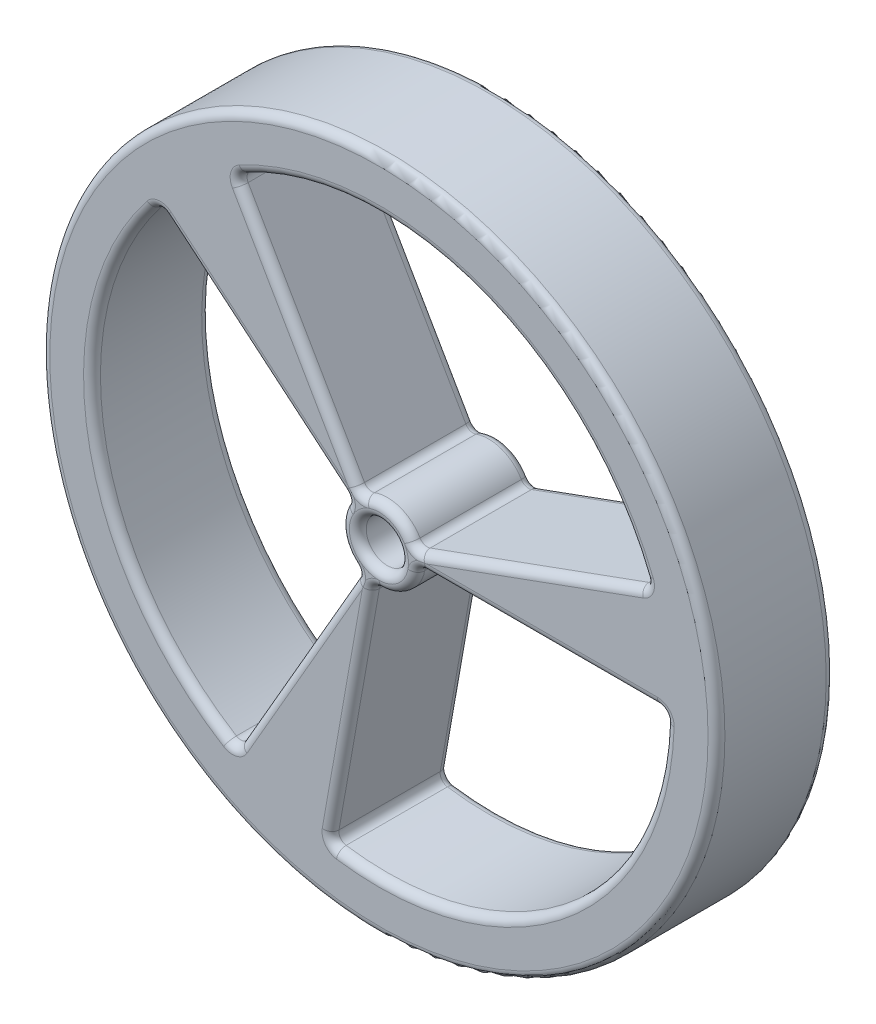
from build123d import *

# Parameters (mm, degrees)
SKETCH1_R           = 20
SKETCH1_R_2         = 1.2500000000000002
BOSS_EXTRUDE1_DEPTH = 7
FILLET1_R           = 0.5


with BuildPart() as part:
    # Sketch1 → Boss-Extrude1 (new body)
    with BuildSketch(Plane.XY):
        Circle(SKETCH1_R)
        Circle(SKETCH1_R_2, mode=Mode.SUBTRACT)
        with BuildLine():
            Line((2.2500000000000004, 2.2e-16), (17, 0))
            ThreePointArc((17, 0), (10.927389364671175, -13.02275553302262), (-2.952019020337799, -16.74173180120754))
            Line((-2.952019020337799, -16.74173180120754), (-0.3907083997505899, -2.2158174442774694))
            ThreePointArc((-0.3907083997505899, -2.2158174442774694), (1.4462721217947154, -1.7235999970177003), (2.2500000000000004, 2.2e-16))
        make_face(mode=Mode.SUBTRACT)
        with BuildLine():
            Line((2.114308396768293, 0.7695453224827578), (15.974774553360438, 5.81434243653638))
            ThreePointArc((15.974774553360438, 5.81434243653638), (5.814342436536355, 15.974774553360447), (-8.500000000000007, 14.722431864335453))
            Line((-8.500000000000007, 14.722431864335453), (-1.124999999999982, 1.9485571585149977))
            ThreePointArc((-1.124999999999982, 1.9485571585149977), (0.769545322482763, 2.1143083967682914), (2.114308396768293, 0.7695453224827578))
        make_face(mode=Mode.SUBTRACT)
        with BuildLine():
            Line((-1.1250000000000093, -1.9485571585149826), (-8.499999999999996, -14.72243186433546))
            ThreePointArc((-8.499999999999996, -14.72243186433546), (-16.741731801207536, -2.9520190203378256), (-13.022755533022641, 10.927389364671152))
            Line((-13.022755533022641, 10.927389364671152), (-1.7235999970177038, 1.4462721217947108))
            ThreePointArc((-1.7235999970177038, 1.4462721217947108), (-2.21581744427747, -0.3907083997505898), (-1.1250000000000093, -1.9485571585149826))
        make_face(mode=Mode.SUBTRACT)
    extrude(amount=BOSS_EXTRUDE1_DEPTH)

    # Fillet1
    # the kernel refuses this fillet: 0.5 mm, written as the material it adds along each edge
    with BuildSketch(Plane(origin=(2.2500000000000004, 1.6e-16, 0), x_dir=(-0.09129028963796376, -0.9958243233712545, 0), z_dir=(0, 0, 1))) as fillet1_piece_1:
        with BuildLine():
            CenterArc((0.45645144818981753, 0.4979121616856275), FILLET1_R, 185.23784084819494, 79.52431830361013)
            Line((-0.04146071349580971, 0.45226701686664567), (0, 0))
            ThreePointArc((0, 0), (0.20540315168541826, 0.00939527241467802), (0.410806303370836, 0))
        make_face()
    extrude(amount=7)
    with BuildSketch(Plane(origin=(-0.39070839975058996, -2.2158174442774694, 0), x_dir=(-0.17364817766692953, -0.9848077530122082, 0), z_dir=(0, 0, 1))) as fillet1_piece_2:
        with BuildLine():
            CenterArc((0.45416345659799273, 0.5), FILLET1_R, 190.47568169638987, 79.52431830361013)
            ThreePointArc((-0.03750262641982422, 0.4090909090909092), (-0.00939527241467734, 0.2054031516854181), (0, 0))
            Line((0, 0), (0.4541634565979929, -1e-17))
        make_face()
    extrude(amount=7)
    with BuildSketch(Plane(origin=(-2.952019020337798, -16.741731801207536, 0), x_dir=(0.1736481776669282, 0.9848077530122085, 0), z_dir=(0, 0, 1))) as fillet1_piece_3:
        with BuildLine():
            CenterArc((0.507577497529364, -0.5000000000000001), FILLET1_R, 90.0000000000001, 91.73650157593738)
            ThreePointArc((0.00780711866661539, -0.5151515151515117), (0.00195189172197935, -0.25760533508876227), (0, 0))
            Line((0, 0), (0.5075774975293631, 0))
        make_face()
    extrude(amount=7)
    with BuildSketch(Plane(origin=(17, 0, 0), x_dir=(-1, 0, 0), z_dir=(0, 0, 1))) as fillet1_piece_4:
        with BuildLine():
            CenterArc((0.5075774975293577, 0.5), FILLET1_R, 178.26349842406205, 91.73650157593795)
            ThreePointArc((0.00780711866661221, 0.5151515151515155), (0.0019518917219834, 0.25760533508876354), (0, 0))
            Line((0, 0), (0.5075774975293577, 0))
        make_face()
    extrude(amount=7)
    with BuildSketch(Plane(origin=(-1.124999999999982, 1.9485571585149977, 0), x_dir=(0.9080543065649411, 0.4188524517403044, 0), z_dir=(0, 0, 1))) as fillet1_piece_5:
        with BuildLine():
            CenterArc((0.4564514481898126, 0.4979121616856273), FILLET1_R, 185.23784084819536, 79.52431830360973)
            Line((-0.04146071349581421, 0.45226701686664206), (0, 0))
            ThreePointArc((0, 0), (0.2054031516854157, 0.00939527241467739), (0.4108063033708312, -1e-17))
        make_face()
    extrude(amount=7)
    with BuildSketch(Plane(origin=(2.114308396768293, 0.7695453224827578, 0), x_dir=(0.9396926207859083, 0.342020143325669, 0), z_dir=(0, 0, 1))) as fillet1_piece_6:
        with BuildLine():
            CenterArc((0.45416345659799173, 0.5), FILLET1_R, 190.47568169638987, 79.52431830361013)
            ThreePointArc((-0.0375026264198251, 0.40909090909090934), (-0.00939527241467807, 0.20540315168541814), (0, 0))
            Line((0, 0), (0.4541634565979919, 0))
        make_face()
    extrude(amount=7)
    with BuildSketch(Plane(origin=(15.974774553360438, 5.81434243653638, 0), x_dir=(-0.3562202754534076, 0.934402009499069, 0), z_dir=(0, 0, 1))) as fillet1_piece_7:
        with BuildLine():
            CenterArc((0.5076340426749175, 0.4999425914199416), FILLET1_R, 179.13174921203125, 91.7365015759375)
            Line((0.00769145125497602, 0.5075192189225506), (0, 0))
            ThreePointArc((0, 0), (0.2576053350887624, -0.00195189172198738), (0.5152106701775263, -1e-17))
        make_face()
    extrude(amount=7)
    with BuildSketch(Plane(origin=(-8.500000000000007, 14.722431864335451, 0), x_dir=(0.8735025967095982, 0.4868194876353957, 0), z_dir=(0, 0, 1))) as fillet1_piece_8:
        with BuildLine():
            CenterArc((0.5076340426749291, -0.4999425914199411), FILLET1_R, 89.13174921203108, 91.73650157594159)
            Line((0.00769145125498728, -0.5075192189225846), (0, 0))
            ThreePointArc((0, 0), (0.2576053350887707, 0.00195189172198515), (0.5152106701775395, -3e-17))
        make_face()
    extrude(amount=7)
    with BuildSketch(Plane(origin=(-1.1250000000000093, -1.9485571585149826, 0), x_dir=(-0.8167640169269716, 0.5769718716309467, 0), z_dir=(0, 0, 1))) as fillet1_piece_9:
        with BuildLine():
            CenterArc((0.4564514481898149, 0.49791216168562746), FILLET1_R, 185.23784084819533, 79.52431830360979)
            Line((-0.0414607134958118, 0.4522670168666425), (0, 0))
            ThreePointArc((0, 0), (0.20540315168541656, 0.00939527241467738), (0.41080630337083374, 2e-17))
        make_face()
    extrude(amount=7)
    with BuildSketch(Plane(origin=(-1.723599997017704, 1.4462721217947108, 0), x_dir=(-0.570171117399639, -0.8215259563052449, 0), z_dir=(0, 0, 1))) as fillet1_piece_10:
        with BuildLine():
            CenterArc((0.4564514481898163, -0.49791216168562724), FILLET1_R, 95.23784084819494, 79.52431830361033)
            Line((-0.04146071349581091, -0.45226701686664733), (0, 0))
            ThreePointArc((0, 0), (0.20540315168541748, -0.00939527241467721), (0.4108063033708347, 1e-17))
        make_face()
    extrude(amount=7)
    with BuildSketch(Plane(origin=(-13.022755533022641, 10.927389364671152, 0), x_dir=(-0.6311057398467204, -0.7756968126352742, 0), z_dir=(0, 0, 1))) as fillet1_piece_11:
        with BuildLine():
            CenterArc((0.507634042674936, 0.49994259141994163), FILLET1_R, 179.13174921203353, 91.73650157593528)
            Line((0.0076914512549941, 0.5075192189225307), (0, 0))
            ThreePointArc((0, 0), (0.2576053350887728, -0.00195189172198576), (0.5152106701775455, 0))
        make_face()
    extrude(amount=7)
    with BuildSketch(Plane(origin=(-8.499999999999996, -14.72243186433546, 0), x_dir=(0.5000000000000008, 0.8660254037844382, 0), z_dir=(0, 0, 1))) as fillet1_piece_12:
        with BuildLine():
            CenterArc((0.5075774975293567, 0.4999999999999995), FILLET1_R, 178.2634984240622, 91.73650157593784)
            ThreePointArc((0.00780711866660927, 0.5151515151515137), (0.001951891721983, 0.2576053350887633), (0, 0))
            Line((0, 0), (0.5075774975293569, 1e-17))
        make_face()
    extrude(amount=7)
    # the kernel refuses this fillet: 0.5 mm, written as the material it takes off along each edge
    with BuildSketch(Plane(origin=(0, 0, 0), x_dir=(1, 0, 0), z_dir=(0, -1, 0))) as fillet1_2_piece_1:
        with BuildLine():
            CenterArc((20 - FILLET1_R, FILLET1_R), FILLET1_R, 270, 90)
            Line((20 - FILLET1_R, -6e-17), (20, 0))
            Line((20, 0), (20, FILLET1_R))
        make_face()
    revolve(axis=Axis((0, 0, 0), (0, 0, 1)), mode=Mode.SUBTRACT)
    with BuildSketch(Plane(origin=(0, 0, 7), x_dir=(1, 0, 0), z_dir=(0, -1, 0))) as fillet1_2_piece_2:
        with BuildLine():
            CenterArc((20 - FILLET1_R, -FILLET1_R), FILLET1_R, 0, 90)
            Line((20 - FILLET1_R, 0), (20, 0))
            Line((20, 0), (20, -FILLET1_R))
        make_face()
    revolve(axis=Axis((0, 0, 7), (0, 0, 1)), mode=Mode.SUBTRACT)
    with BuildSketch(Plane(origin=(0, 0, 0), x_dir=(1, 0, 0), z_dir=(0, -1, 0))) as fillet1_2_piece_3:
        with BuildLine():
            CenterArc((1.2500000000000002 + FILLET1_R, FILLET1_R), FILLET1_R, 180, 90)
            Line((1.2500000000000002, FILLET1_R), (1.2500000000000002, 0))
            Line((1.2500000000000002, 0), (1.2500000000000002 + FILLET1_R, 0))
        make_face()
    revolve(axis=Axis((0, 0, 0), (0, 0, 1)), mode=Mode.SUBTRACT)
    with BuildSketch(Plane(origin=(0, 0, 7), x_dir=(1, 0, 0), z_dir=(0, -1, 0))) as fillet1_2_piece_4:
        with BuildLine():
            CenterArc((1.2500000000000002 + FILLET1_R, -FILLET1_R), FILLET1_R, 90, 90)
            Line((1.2500000000000002, -FILLET1_R), (1.2500000000000002, 0))
            Line((1.2500000000000002, 0), (1.2500000000000002 + FILLET1_R, 0))
        make_face()
    revolve(axis=Axis((0, 0, 7), (0, 0, 1)), mode=Mode.SUBTRACT)
    # the kernel refuses this fillet: 0.5 mm, written as the material it takes off along each edge
    with BuildSketch(Plane(origin=(4.4e-16, -7.2e-16, 0), x_dir=(0.008302116419766921, -0.9999655368376216, 0), z_dir=(-0.9999655368376216, -0.008302116419766921, 0))) as fillet1_3_piece_1:
        with BuildLine():
            CenterArc((2.2500000000000004 - FILLET1_R, FILLET1_R), FILLET1_R, 270, 90)
            Line((2.2500000000000004, FILLET1_R), (2.2500000000000004, 0))
            Line((2.2500000000000004, 0), (2.2500000000000004 - FILLET1_R, 0))
        make_face()
    revolve(axis=Axis((4.4e-16, -7.2e-16, 0), (0, 0, 1)), revolution_arc=79.04863660722016, mode=Mode.SUBTRACT)
    with BuildSketch(Plane(origin=(-2.863879112867084, -16.241865546386084, 0), x_dir=(-0.9848077530122082, 0.17364817766692942, 0), z_dir=(0.17364817766692944, 0.9848077530122082, 0))) as fillet1_3_piece_2:
        with BuildLine():
            CenterArc((FILLET1_R, FILLET1_R), FILLET1_R, 180, 90)
            Line((-4.4e-16, FILLET1_R), (0, 0))
            Line((0, 0), (FILLET1_R, 0))
        make_face()
    extrude(amount=13.788259045872639, mode=Mode.SUBTRACT)
    with BuildSketch(Plane(origin=(-7.55e-15, 1.11e-14, 0), x_dir=(0.9995407577254936, -0.03030303030303098, 0), z_dir=(0.03030303030303098, 0.9995407577254936, 0))) as fillet1_3_piece_3:
        with BuildLine():
            CenterArc((17.000000000000007 + FILLET1_R, -FILLET1_R), FILLET1_R, 90, 90)
            Line((17.000000000000007, -FILLET1_R), (17.000000000000007, 0))
            Line((17.000000000000007, 0), (17.000000000000007 + FILLET1_R, 0))
        make_face()
    revolve(axis=Axis((-7.55e-15, 1.11e-14, 0), (0, 0, -1)), revolution_arc=96.52699684812407, mode=Mode.SUBTRACT)
    with BuildSketch(Plane(origin=(2.7041634565979926, 2.1e-16, 0), x_dir=(1e-17, 1, 0), z_dir=(1, -1e-17, 0))) as fillet1_3_piece_4:
        with BuildLine():
            CenterArc((FILLET1_R, FILLET1_R), FILLET1_R, 180, 90)
            Line((-1e-16, FILLET1_R), (0, 0))
            Line((0, 0), (FILLET1_R, 0))
        make_face()
    extrude(amount=13.78825904587265, mode=Mode.SUBTRACT)
    with BuildSketch(Plane(origin=(4.4e-16, -7.2e-16, 7), x_dir=(0.008302116419766921, -0.9999655368376216, 0), z_dir=(-0.9999655368376216, -0.008302116419766921, 0))) as fillet1_3_piece_5:
        with BuildLine():
            CenterArc((2.2500000000000004 - FILLET1_R, -FILLET1_R), FILLET1_R, 0, 90)
            Line((2.2500000000000004, -FILLET1_R), (2.2500000000000004, 0))
            Line((2.2500000000000004, 0), (2.2500000000000004 - FILLET1_R, 0))
        make_face()
    revolve(axis=Axis((4.4e-16, -7.2e-16, 7), (0, 0, 1)), revolution_arc=79.04863660722016, mode=Mode.SUBTRACT)
    with BuildSketch(Plane(origin=(-2.863879112867084, -16.241865546386084, 7), x_dir=(-0.9848077530122082, 0.17364817766692942, 0), z_dir=(0.17364817766692944, 0.9848077530122082, 0))) as fillet1_3_piece_6:
        with BuildLine():
            CenterArc((FILLET1_R, -FILLET1_R), FILLET1_R, 90, 90)
            Line((-4.4e-16, -FILLET1_R), (0, 0))
            Line((0, 0), (FILLET1_R, 0))
        make_face()
    extrude(amount=13.788259045872639, mode=Mode.SUBTRACT)
    with BuildSketch(Plane(origin=(-7.55e-15, 1.11e-14, 7), x_dir=(0.9995407577254936, -0.03030303030303098, 0), z_dir=(0.03030303030303098, 0.9995407577254936, 0))) as fillet1_3_piece_7:
        with BuildLine():
            CenterArc((17.000000000000007 + FILLET1_R, FILLET1_R), FILLET1_R, 180, 90)
            Line((17.000000000000007, FILLET1_R), (17.000000000000007, 0))
            Line((17.000000000000007, 0), (17.000000000000007 + FILLET1_R, 0))
        make_face()
    revolve(axis=Axis((-7.55e-15, 1.11e-14, 7), (0, 0, -1)), revolution_arc=96.52699684812407, mode=Mode.SUBTRACT)
    with BuildSketch(Plane(origin=(2.7041634565979926, 2.1e-16, 7), x_dir=(1e-17, 1, 0), z_dir=(1, -1e-17, 0))) as fillet1_3_piece_8:
        with BuildLine():
            CenterArc((FILLET1_R, -FILLET1_R), FILLET1_R, 90, 90)
            Line((-1e-16, -FILLET1_R), (0, 0))
            Line((0, 0), (FILLET1_R, 0))
        make_face()
    extrude(amount=13.78825904587265, mode=Mode.SUBTRACT)
    with BuildSketch(Plane(origin=(6e-17, -1.1e-16, 0), x_dir=(-0.3342069186933668, 0.9424997270543294, 0), z_dir=(-0.9424997270543294, -0.3342069186933668, 0))) as fillet1_3_piece_9:
        with BuildLine():
            CenterArc((2.2500000000000004 - FILLET1_R, -FILLET1_R), FILLET1_R, 6.36e-15, 90)
            Line((2.2500000000000004, -FILLET1_R), (2.2500000000000004, 0))
            Line((2.2500000000000004, 0), (2.2500000000000004 - FILLET1_R, 0))
        make_face()
    revolve(axis=Axis((6e-17, -1.1e-16, 0), (0, 0, -1)), revolution_arc=79.04863660721972, mode=Mode.SUBTRACT)
    with BuildSketch(Plane(origin=(2.5410824455640473, 0.9248783730016843, 0), x_dir=(0.3420201433256693, -0.9396926207859082, 0), z_dir=(0.9396926207859082, 0.3420201433256693, 0))) as fillet1_3_piece_10:
        with BuildLine():
            CenterArc((FILLET1_R, -FILLET1_R), FILLET1_R, 90, 90)
            Line((0, -FILLET1_R), (0, 0))
            Line((0, 0), (FILLET1_R, 0))
        make_face()
    extrude(amount=13.788259045872653, mode=Mode.SUBTRACT)
    with BuildSketch(Plane(origin=(-2.2e-16, -1.78e-15, 0), x_dir=(0.9288968274419568, 0.3703386071803309, 0), z_dir=(0.3703386071803309, -0.9288968274419568, 0))) as fillet1_3_piece_11:
        with BuildLine():
            CenterArc((17 + FILLET1_R, FILLET1_R), FILLET1_R, 180, 90)
            Line((16.999999999999996, FILLET1_R), (17, 0))
            Line((17, 0), (17 + FILLET1_R, 0))
        make_face()
    revolve(axis=Axis((-2.2e-16, -1.78e-15, 0), (0, 0, 1)), revolution_arc=96.52699684812413, mode=Mode.SUBTRACT)
    with BuildSketch(Plane(origin=(-8.24621125123531, 14.282856857085667, 0), x_dir=(-0.8660254037844377, -0.5000000000000017, 0), z_dir=(0.5000000000000017, -0.8660254037844377, 0))) as fillet1_3_piece_12:
        with BuildLine():
            CenterArc((FILLET1_R, -FILLET1_R), FILLET1_R, 90, 90)
            Line((-8.9e-16, -FILLET1_R), (0, 0))
            Line((0, 0), (FILLET1_R, 0))
        make_face()
    extrude(amount=13.78825904587262, mode=Mode.SUBTRACT)
    with BuildSketch(Plane(origin=(6e-17, -1.1e-16, 7), x_dir=(-0.3342069186933668, 0.9424997270543294, 0), z_dir=(-0.9424997270543294, -0.3342069186933668, 0))) as fillet1_3_piece_13:
        with BuildLine():
            CenterArc((2.2500000000000004 - FILLET1_R, FILLET1_R), FILLET1_R, 270, 90)
            Line((2.2500000000000004, FILLET1_R), (2.2500000000000004, 0))
            Line((2.2500000000000004, 0), (2.2500000000000004 - FILLET1_R, 0))
        make_face()
    revolve(axis=Axis((6e-17, -1.1e-16, 7), (0, 0, -1)), revolution_arc=79.04863660721972, mode=Mode.SUBTRACT)
    with BuildSketch(Plane(origin=(2.5410824455640473, 0.9248783730016843, 7), x_dir=(0.3420201433256693, -0.9396926207859082, 0), z_dir=(0.9396926207859082, 0.3420201433256693, 0))) as fillet1_3_piece_14:
        with BuildLine():
            CenterArc((FILLET1_R, FILLET1_R), FILLET1_R, 180, 90)
            Line((0, FILLET1_R), (0, 0))
            Line((0, 0), (FILLET1_R, 0))
        make_face()
    extrude(amount=13.788259045872653, mode=Mode.SUBTRACT)
    with BuildSketch(Plane(origin=(-2.2e-16, -1.78e-15, 7), x_dir=(0.9288968274419568, 0.3703386071803309, 0), z_dir=(0.3703386071803309, -0.9288968274419568, 0))) as fillet1_3_piece_15:
        with BuildLine():
            CenterArc((17 + FILLET1_R, -FILLET1_R), FILLET1_R, 90, 90)
            Line((16.999999999999996, -FILLET1_R), (17, 0))
            Line((17, 0), (17 + FILLET1_R, 0))
        make_face()
    revolve(axis=Axis((-2.2e-16, -1.78e-15, 7), (0, 0, 1)), revolution_arc=96.52699684812413, mode=Mode.SUBTRACT)
    with BuildSketch(Plane(origin=(-8.24621125123531, 14.282856857085667, 7), x_dir=(-0.8660254037844377, -0.5000000000000017, 0), z_dir=(0.5000000000000017, -0.8660254037844377, 0))) as fillet1_3_piece_16:
        with BuildLine():
            CenterArc((FILLET1_R, FILLET1_R), FILLET1_R, 180, 90)
            Line((-8.9e-16, FILLET1_R), (0, 0))
            Line((0, 0), (FILLET1_R, 0))
        make_face()
    extrude(amount=13.78825904587262, mode=Mode.SUBTRACT)
    with BuildSketch(Plane(origin=(-3.3e-16, -2.8e-16, 0), x_dir=(-0.8701466160202074, 0.4927929246941169, 0), z_dir=(0.4927929246941169, 0.8701466160202074, 0))) as fillet1_3_piece_17:
        with BuildLine():
            CenterArc((2.2500000000000004 - FILLET1_R, FILLET1_R), FILLET1_R, 270, 90)
            Line((2.2500000000000004, FILLET1_R), (2.2500000000000004, 0))
            Line((2.2500000000000004, 0), (2.2500000000000004 - FILLET1_R, 0))
        make_face()
    revolve(axis=Axis((-3.3e-16, -2.8e-16, 0), (0, 0, 1)), revolution_arc=79.04863660721995, mode=Mode.SUBTRACT)
    with BuildSketch(Plane(origin=(-12.633928611588056, 10.601124838303594, 0), x_dir=(0.6427876096865385, 0.7660444431189789, 0), z_dir=(0.7660444431189789, -0.6427876096865384, 0))) as fillet1_3_piece_18:
        with BuildLine():
            CenterArc((FILLET1_R, FILLET1_R), FILLET1_R, 180, 90)
            Line((0, FILLET1_R), (0, 0))
            Line((0, 0), (FILLET1_R, 0))
        make_face()
    extrude(amount=13.78825904587267, mode=Mode.SUBTRACT)
    with BuildSketch(Plane(origin=(-1.78e-15, -6.7e-16, 0), x_dir=(-0.5260135729168202, -0.8504761731567093, 0), z_dir=(0.8504761731567093, -0.5260135729168202, 0))) as fillet1_3_piece_19:
        with BuildLine():
            CenterArc((16.999999999999996 + FILLET1_R, -FILLET1_R), FILLET1_R, 90, 90)
            Line((16.999999999999996, -FILLET1_R), (16.999999999999996, 0))
            Line((16.999999999999996, 0), (16.999999999999996 + FILLET1_R, 0))
        make_face()
    revolve(axis=Axis((-1.78e-15, -6.7e-16, 0), (0, 0, -1)), revolution_arc=96.52699684812407, mode=Mode.SUBTRACT)
    with BuildSketch(Plane(origin=(-1.3520817282990034, -2.341874249399393, 0), x_dir=(0.8660254037844392, -0.4999999999999991, 0), z_dir=(-0.4999999999999991, -0.8660254037844392, 0))) as fillet1_3_piece_20:
        with BuildLine():
            CenterArc((FILLET1_R, FILLET1_R), FILLET1_R, 180, 90)
            Line((-2.2e-16, FILLET1_R), (0, 0))
            Line((0, 0), (FILLET1_R, 0))
        make_face()
    extrude(amount=13.788259045872655, mode=Mode.SUBTRACT)
    with BuildSketch(Plane(origin=(-3.3e-16, -2.8e-16, 7), x_dir=(-0.8701466160202074, 0.4927929246941169, 0), z_dir=(0.4927929246941169, 0.8701466160202074, 0))) as fillet1_3_piece_21:
        with BuildLine():
            CenterArc((2.2500000000000004 - FILLET1_R, -FILLET1_R), FILLET1_R, 0, 90)
            Line((2.2500000000000004, -FILLET1_R), (2.2500000000000004, 0))
            Line((2.2500000000000004, 0), (2.2500000000000004 - FILLET1_R, 0))
        make_face()
    revolve(axis=Axis((-3.3e-16, -2.8e-16, 7), (0, 0, 1)), revolution_arc=79.04863660721995, mode=Mode.SUBTRACT)
    with BuildSketch(Plane(origin=(-12.633928611588056, 10.601124838303594, 7), x_dir=(0.6427876096865385, 0.7660444431189789, 0), z_dir=(0.7660444431189789, -0.6427876096865384, 0))) as fillet1_3_piece_22:
        with BuildLine():
            CenterArc((FILLET1_R, -FILLET1_R), FILLET1_R, 90, 90)
            Line((0, -FILLET1_R), (0, 0))
            Line((0, 0), (FILLET1_R, 0))
        make_face()
    extrude(amount=13.78825904587267, mode=Mode.SUBTRACT)
    with BuildSketch(Plane(origin=(-1.78e-15, -6.7e-16, 7), x_dir=(-0.5260135729168202, -0.8504761731567093, 0), z_dir=(0.8504761731567093, -0.5260135729168202, 0))) as fillet1_3_piece_23:
        with BuildLine():
            CenterArc((16.999999999999996 + FILLET1_R, FILLET1_R), FILLET1_R, 180, 90)
            Line((16.999999999999996, FILLET1_R), (16.999999999999996, 0))
            Line((16.999999999999996, 0), (16.999999999999996 + FILLET1_R, 0))
        make_face()
    revolve(axis=Axis((-1.78e-15, -6.7e-16, 7), (0, 0, -1)), revolution_arc=96.52699684812407, mode=Mode.SUBTRACT)
    with BuildSketch(Plane(origin=(-1.3520817282990034, -2.341874249399393, 7), x_dir=(0.8660254037844392, -0.4999999999999991, 0), z_dir=(-0.4999999999999991, -0.8660254037844392, 0))) as fillet1_3_piece_24:
        with BuildLine():
            CenterArc((FILLET1_R, -FILLET1_R), FILLET1_R, 90, 90)
            Line((-2.2e-16, -FILLET1_R), (0, 0))
            Line((0, 0), (FILLET1_R, 0))
        make_face()
    extrude(amount=13.788259045872655, mode=Mode.SUBTRACT)
    with BuildSketch(Plane(origin=(-1.785094430191223, -2.091874249399394, 7), x_dir=(0.6491252473422627, 0.7606815452361431, 0), z_dir=(-0.7606815452361431, 0.6491252473422627, 0))) as fillet1_3_piece_25:
        with BuildLine():
            CenterArc((0.5000000000000002 + FILLET1_R, FILLET1_R), FILLET1_R, 180, 90)
            Line((0.5, FILLET1_R), (0.5000000000000002, 0))
            Line((0.5000000000000002, 0), (0.5000000000000002 + FILLET1_R, 0))
        make_face()
    revolve(axis=Axis((-1.785094430191223, -2.091874249399394, 7), (0, 0, -1)), revolution_arc=79.5243183036098, mode=Mode.SUBTRACT)
    with BuildSketch(Plane(origin=(-8.679223953127536, -14.032856857085704, 7), x_dir=(0.8660254037844384, -0.5000000000000006, 0), z_dir=(0.5000000000000006, 0.8660254037844384, 0))) as fillet1_3_piece_26:
        with BuildLine():
            CenterArc((0.49999999999999956 + FILLET1_R, FILLET1_R), FILLET1_R, 180, 90)
            Line((0.4999999999999993, FILLET1_R), (0.49999999999999956, 0))
            Line((0.49999999999999956, 0), (0.49999999999999956 + FILLET1_R, 0))
        make_face()
    revolve(axis=Axis((-8.679223953127536, -14.032856857085704, 7), (0, 0, -1)), revolution_arc=91.73650157593784, mode=Mode.SUBTRACT)
    with BuildSketch(Plane(origin=(-12.95532241643132, 10.218102616744076, 7), x_dir=(-0.7851710555412907, 0.6192789464693398, 0), z_dir=(-0.6192789464693398, -0.7851710555412907, 0))) as fillet1_3_piece_27:
        with BuildLine():
            CenterArc((0.5 + FILLET1_R, FILLET1_R), FILLET1_R, 180, 90)
            Line((0.5, FILLET1_R), (0.5, 0))
            Line((0.5, 0), (0.5 + FILLET1_R, 0))
        make_face()
    revolve(axis=Axis((-12.95532241643132, 10.218102616744076, 7), (0, 0, -1)), revolution_arc=91.7365015759353, mode=Mode.SUBTRACT)
    with BuildSketch(Plane(origin=(-2.3929031940555716, 1.3551805429088217, 7), x_dir=(0.8701466160202075, -0.492792924694117, 0), z_dir=(-0.492792924694117, -0.8701466160202075, 0))) as fillet1_3_piece_28:
        with BuildLine():
            CenterArc((0.49999999999999994 + FILLET1_R, -FILLET1_R), FILLET1_R, 90, 90)
            Line((0.49999999999999994, -FILLET1_R), (0.49999999999999994, 0))
            Line((0.49999999999999994, 0), (0.49999999999999994 + FILLET1_R, 0))
        make_face()
    revolve(axis=Axis((-2.3929031940555716, 1.3551805429088217, 7), (0, 0, 1)), revolution_arc=79.52431830361033, mode=Mode.SUBTRACT)
    with BuildSketch(Plane(origin=(-1.785094430191223, -2.091874249399394, 0), x_dir=(0.6491252473422627, 0.7606815452361431, 0), z_dir=(-0.7606815452361431, 0.6491252473422627, 0))) as fillet1_3_piece_29:
        with BuildLine():
            CenterArc((0.5000000000000002 + FILLET1_R, -FILLET1_R), FILLET1_R, 90, 90)
            Line((0.5, -FILLET1_R), (0.5000000000000002, 0))
            Line((0.5000000000000002, 0), (0.5000000000000002 + FILLET1_R, 0))
        make_face()
    revolve(axis=Axis((-1.785094430191223, -2.091874249399394, 0), (0, 0, -1)), revolution_arc=79.5243183036098, mode=Mode.SUBTRACT)
    with BuildSketch(Plane(origin=(-8.679223953127536, -14.032856857085704, 0), x_dir=(0.8660254037844384, -0.5000000000000006, 0), z_dir=(0.5000000000000006, 0.8660254037844384, 0))) as fillet1_3_piece_30:
        with BuildLine():
            CenterArc((0.49999999999999956 + FILLET1_R, -FILLET1_R), FILLET1_R, 90, 90)
            Line((0.4999999999999993, -FILLET1_R), (0.49999999999999956, 0))
            Line((0.49999999999999956, 0), (0.49999999999999956 + FILLET1_R, 0))
        make_face()
    revolve(axis=Axis((-8.679223953127536, -14.032856857085704, 0), (0, 0, -1)), revolution_arc=91.73650157593784, mode=Mode.SUBTRACT)
    with BuildSketch(Plane(origin=(-12.95532241643132, 10.218102616744076, 0), x_dir=(-0.7851710555412907, 0.6192789464693398, 0), z_dir=(-0.6192789464693398, -0.7851710555412907, 0))) as fillet1_3_piece_31:
        with BuildLine():
            CenterArc((0.5 + FILLET1_R, -FILLET1_R), FILLET1_R, 90, 90)
            Line((0.5, -FILLET1_R), (0.5, 0))
            Line((0.5, 0), (0.5 + FILLET1_R, 0))
        make_face()
    revolve(axis=Axis((-12.95532241643132, 10.218102616744076, 0), (0, 0, -1)), revolution_arc=91.7365015759353, mode=Mode.SUBTRACT)
    with BuildSketch(Plane(origin=(-2.3929031940555716, 1.3551805429088217, 0), x_dir=(0.8701466160202075, -0.492792924694117, 0), z_dir=(-0.492792924694117, -0.8701466160202075, 0))) as fillet1_3_piece_32:
        with BuildLine():
            CenterArc((0.49999999999999994 + FILLET1_R, FILLET1_R), FILLET1_R, 180, 90)
            Line((0.49999999999999994, FILLET1_R), (0.49999999999999994, 0))
            Line((0.49999999999999994, 0), (0.49999999999999994 + FILLET1_R, 0))
        make_face()
    revolve(axis=Axis((-2.3929031940555716, 1.3551805429088217, 0), (0, 0, 1)), revolution_arc=79.52431830361033, mode=Mode.SUBTRACT)
    with BuildSketch(Plane(origin=(-7.813198549343098, 14.5328568570857, 7), x_dir=(-0.47352718480867273, 0.8807792034597395, 0), z_dir=(0.8807792034597395, 0.47352718480867273, 0))) as fillet1_3_piece_33:
        with BuildLine():
            CenterArc((0.4999999999999994 + FILLET1_R, -FILLET1_R), FILLET1_R, 90, 90)
            Line((0.4999999999999994, -FILLET1_R), (0.4999999999999994, 0))
            Line((0.4999999999999994, 0), (0.4999999999999994 + FILLET1_R, 0))
        make_face()
    revolve(axis=Axis((-7.813198549343098, 14.5328568570857, 7), (0, 0, 1)), revolution_arc=91.73650157594165, mode=Mode.SUBTRACT)
    with BuildSketch(Plane(origin=(-0.9190690264067585, 2.5918742493994062, 7), x_dir=(0.3342069186933667, -0.9424997270543294, 0), z_dir=(0.9424997270543294, 0.3342069186933667, 0))) as fillet1_3_piece_34:
        with BuildLine():
            CenterArc((0.5 + FILLET1_R, FILLET1_R), FILLET1_R, 180, 90)
            Line((0.5, FILLET1_R), (0.5, 0))
            Line((0.5, 0), (0.5 + FILLET1_R, 0))
        make_face()
    revolve(axis=Axis((-0.9190690264067585, 2.5918742493994062, 7), (0, 0, -1)), revolution_arc=79.52431830360975, mode=Mode.SUBTRACT)
    with BuildSketch(Plane(origin=(15.326797652792289, 6.110587018475457, 7), x_dir=(0.9288968274419568, 0.37033860718033124, 0), z_dir=(-0.37033860718033124, 0.9288968274419568, 0))) as fillet1_3_piece_35:
        with BuildLine():
            CenterArc((0.5 + FILLET1_R, FILLET1_R), FILLET1_R, 180, 90)
            Line((0.500000000000002, FILLET1_R), (0.5, 0))
            Line((0.5, 0), (0.5 + FILLET1_R, 0))
        make_face()
    revolve(axis=Axis((15.326797652792289, 6.110587018475457, 7), (0, 0, -1)), revolution_arc=91.7365015759375, mode=Mode.SUBTRACT)
    with BuildSketch(Plane(origin=(2.3700723739012126, 1.3947246833946383, 7), x_dir=(0.3420201433256693, -0.9396926207859082, 0), z_dir=(0.9396926207859082, 0.3420201433256693, 0))) as fillet1_3_piece_36:
        with BuildLine():
            CenterArc((0.5 + FILLET1_R, FILLET1_R), FILLET1_R, 180, 90)
            Line((0.49999999999999994, FILLET1_R), (0.5, 0))
            Line((0.5, 0), (0.5 + FILLET1_R, 0))
        make_face()
    revolve(axis=Axis((2.3700723739012126, 1.3947246833946383, 7), (0, 0, -1)), revolution_arc=79.52431830361016, mode=Mode.SUBTRACT)
    with BuildSketch(Plane(origin=(-7.813198549343098, 14.5328568570857, 0), x_dir=(-0.47352718480867273, 0.8807792034597395, 0), z_dir=(0.8807792034597395, 0.47352718480867273, 0))) as fillet1_3_piece_37:
        with BuildLine():
            CenterArc((0.4999999999999994 + FILLET1_R, FILLET1_R), FILLET1_R, 180, 90)
            Line((0.4999999999999994, FILLET1_R), (0.4999999999999994, 0))
            Line((0.4999999999999994, 0), (0.4999999999999994 + FILLET1_R, 0))
        make_face()
    revolve(axis=Axis((-7.813198549343098, 14.5328568570857, 0), (0, 0, 1)), revolution_arc=91.73650157594165, mode=Mode.SUBTRACT)
    with BuildSketch(Plane(origin=(-0.9190690264067585, 2.5918742493994062, 0), x_dir=(0.3342069186933667, -0.9424997270543294, 0), z_dir=(0.9424997270543294, 0.3342069186933667, 0))) as fillet1_3_piece_38:
        with BuildLine():
            CenterArc((0.5 + FILLET1_R, -FILLET1_R), FILLET1_R, 90, 90)
            Line((0.5, -FILLET1_R), (0.5, 0))
            Line((0.5, 0), (0.5 + FILLET1_R, 0))
        make_face()
    revolve(axis=Axis((-0.9190690264067585, 2.5918742493994062, 0), (0, 0, -1)), revolution_arc=79.52431830360975, mode=Mode.SUBTRACT)
    with BuildSketch(Plane(origin=(15.326797652792289, 6.110587018475457, 0), x_dir=(0.9288968274419568, 0.37033860718033124, 0), z_dir=(-0.37033860718033124, 0.9288968274419568, 0))) as fillet1_3_piece_39:
        with BuildLine():
            CenterArc((0.5 + FILLET1_R, -FILLET1_R), FILLET1_R, 90, 90)
            Line((0.500000000000002, -FILLET1_R), (0.5, 0))
            Line((0.5, 0), (0.5 + FILLET1_R, 0))
        make_face()
    revolve(axis=Axis((15.326797652792289, 6.110587018475457, 0), (0, 0, -1)), revolution_arc=91.7365015759375, mode=Mode.SUBTRACT)
    with BuildSketch(Plane(origin=(2.3700723739012126, 1.3947246833946383, 0), x_dir=(0.3420201433256693, -0.9396926207859082, 0), z_dir=(0.9396926207859082, 0.3420201433256693, 0))) as fillet1_3_piece_40:
        with BuildLine():
            CenterArc((0.5 + FILLET1_R, -FILLET1_R), FILLET1_R, 90, 90)
            Line((0.49999999999999994, -FILLET1_R), (0.5, 0))
            Line((0.5, 0), (0.5 + FILLET1_R, 0))
        make_face()
    revolve(axis=Axis((2.3700723739012126, 1.3947246833946383, 0), (0, 0, -1)), revolution_arc=79.52431830361016, mode=Mode.SUBTRACT)
    with BuildSketch(Plane(origin=(2.7041634565979926, -0.49999999999999967, 7), x_dir=(-0.9833321660356336, 0.18181818181818135, 0), z_dir=(-0.18181818181818135, -0.9833321660356336, 0))) as fillet1_3_piece_41:
        with BuildLine():
            CenterArc((0.5000000000000002 + FILLET1_R, FILLET1_R), FILLET1_R, 180, 90)
            Line((0.5000000000000002, FILLET1_R), (0.5000000000000002, 0))
            Line((0.5000000000000002, 0), (0.5000000000000002 + FILLET1_R, 0))
        make_face()
    revolve(axis=Axis((2.7041634565979926, -0.49999999999999967, 7), (0, 0, -1)), revolution_arc=79.52431830361013, mode=Mode.SUBTRACT)
    with BuildSketch(Plane(origin=(16.492422502470642, -0.5, 7), x_dir=(0, 1, 0), z_dir=(-1, 0, 0))) as fillet1_3_piece_42:
        with BuildLine():
            CenterArc((0.5 + FILLET1_R, FILLET1_R), FILLET1_R, 180, 90)
            Line((0.49999999999999994, FILLET1_R), (0.5, 0))
            Line((0.5, 0), (0.5 + FILLET1_R, 0))
        make_face()
    revolve(axis=Axis((16.492422502470642, -0.5, 7), (0, 0, -1)), revolution_arc=91.73650157593796, mode=Mode.SUBTRACT)
    with BuildSketch(Plane(origin=(-2.37147523636098, -16.328689635219547, 7), x_dir=(-0.9848077530122088, 0.1736481776669265, 0), z_dir=(0.1736481776669265, 0.9848077530122088, 0))) as fillet1_3_piece_43:
        with BuildLine():
            CenterArc((0.5000000000000002 + FILLET1_R, -FILLET1_R), FILLET1_R, 90, 90)
            Line((0.5, -FILLET1_R), (0.5000000000000002, 0))
            Line((0.5000000000000002, 0), (0.5000000000000002 + FILLET1_R, 0))
        make_face()
    revolve(axis=Axis((-2.37147523636098, -16.328689635219547, 7), (0, 0, 1)), revolution_arc=91.7365015759374, mode=Mode.SUBTRACT)
    with BuildSketch(Plane(origin=(0.02283082015435905, -2.749905226303461, 7), x_dir=(-0.9848077530122084, 0.1736481776669292, 0), z_dir=(-0.1736481776669292, -0.9848077530122084, 0))) as fillet1_3_piece_44:
        with BuildLine():
            CenterArc((0.5000000000000001 + FILLET1_R, FILLET1_R), FILLET1_R, 180, 90)
            Line((0.5000000000000001, FILLET1_R), (0.5000000000000001, 0))
            Line((0.5000000000000001, 0), (0.5000000000000001 + FILLET1_R, 0))
        make_face()
    revolve(axis=Axis((0.02283082015435905, -2.749905226303461, 7), (0, 0, -1)), revolution_arc=79.52431830361014, mode=Mode.SUBTRACT)
    with BuildSketch(Plane(origin=(2.7041634565979926, -0.49999999999999967, 0), x_dir=(-0.9833321660356336, 0.18181818181818135, 0), z_dir=(-0.18181818181818135, -0.9833321660356336, 0))) as fillet1_3_piece_45:
        with BuildLine():
            CenterArc((0.5000000000000002 + FILLET1_R, -FILLET1_R), FILLET1_R, 90, 90)
            Line((0.5000000000000002, -FILLET1_R), (0.5000000000000002, 0))
            Line((0.5000000000000002, 0), (0.5000000000000002 + FILLET1_R, 0))
        make_face()
    revolve(axis=Axis((2.7041634565979926, -0.49999999999999967, 0), (0, 0, -1)), revolution_arc=79.52431830361013, mode=Mode.SUBTRACT)
    with BuildSketch(Plane(origin=(16.492422502470642, -0.5, 0), x_dir=(0, 1, 0), z_dir=(-1, 0, 0))) as fillet1_3_piece_46:
        with BuildLine():
            CenterArc((0.5 + FILLET1_R, -FILLET1_R), FILLET1_R, 90, 90)
            Line((0.49999999999999994, -FILLET1_R), (0.5, 0))
            Line((0.5, 0), (0.5 + FILLET1_R, 0))
        make_face()
    revolve(axis=Axis((16.492422502470642, -0.5, 0), (0, 0, -1)), revolution_arc=91.73650157593796, mode=Mode.SUBTRACT)
    with BuildSketch(Plane(origin=(-2.37147523636098, -16.328689635219547, 0), x_dir=(-0.9848077530122088, 0.1736481776669265, 0), z_dir=(0.1736481776669265, 0.9848077530122088, 0))) as fillet1_3_piece_47:
        with BuildLine():
            CenterArc((0.5000000000000002 + FILLET1_R, FILLET1_R), FILLET1_R, 180, 90)
            Line((0.5, FILLET1_R), (0.5000000000000002, 0))
            Line((0.5000000000000002, 0), (0.5000000000000002 + FILLET1_R, 0))
        make_face()
    revolve(axis=Axis((-2.37147523636098, -16.328689635219547, 0), (0, 0, 1)), revolution_arc=91.7365015759374, mode=Mode.SUBTRACT)
    with BuildSketch(Plane(origin=(0.02283082015435905, -2.749905226303461, 0), x_dir=(-0.9848077530122084, 0.1736481776669292, 0), z_dir=(-0.1736481776669292, -0.9848077530122084, 0))) as fillet1_3_piece_48:
        with BuildLine():
            CenterArc((0.5000000000000001 + FILLET1_R, -FILLET1_R), FILLET1_R, 90, 90)
            Line((0.5000000000000001, -FILLET1_R), (0.5000000000000001, 0))
            Line((0.5000000000000001, 0), (0.5000000000000001 + FILLET1_R, 0))
        make_face()
    revolve(axis=Axis((0.02283082015435905, -2.749905226303461, 0), (0, 0, -1)), revolution_arc=79.52431830361014, mode=Mode.SUBTRACT)


solid = part.part
